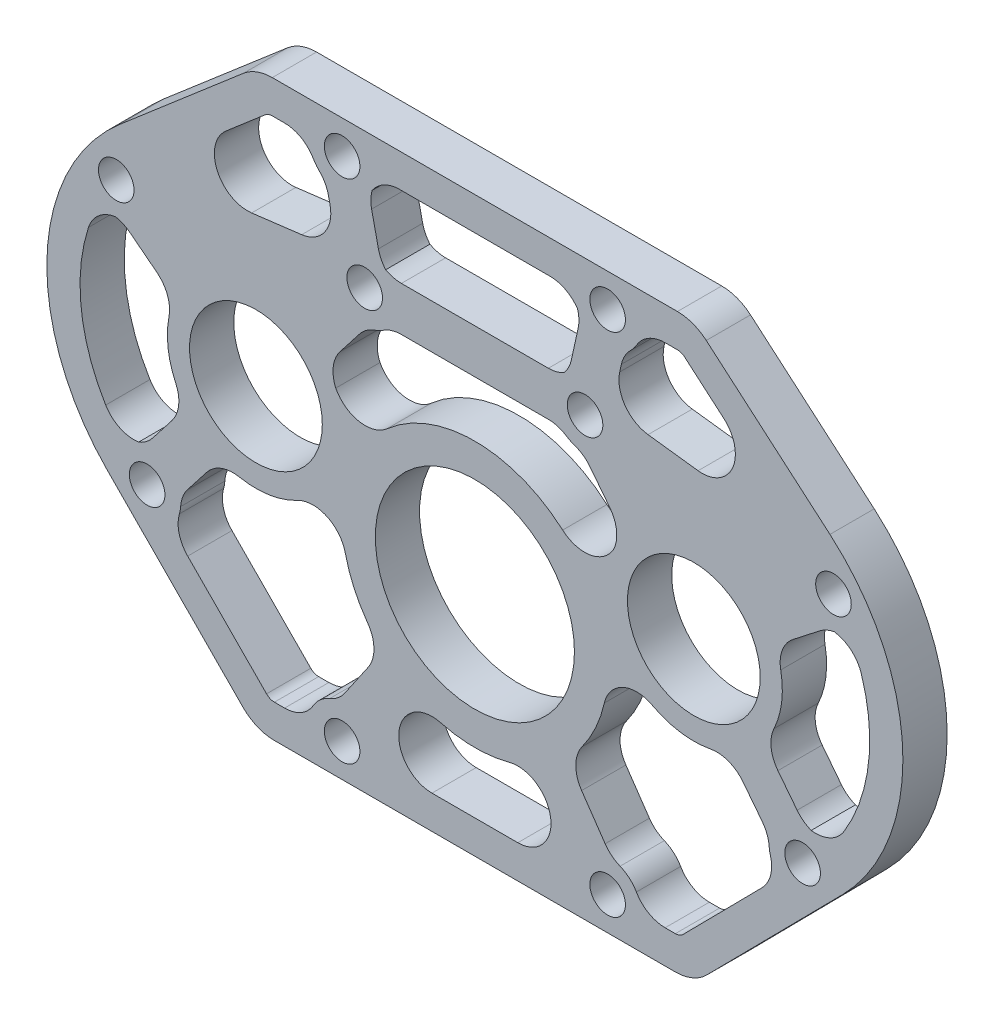
from build123d import *

# Parameters (mm, degrees)
SKETCH3_R           = 9.524999999999967
SKETCH3_R_2         = 14.287499999999966
SKETCH3_R_3         = 9.525000000000205
SKETCH3_R_4         = 2.552699999999982
SKETCH3_R_5         = 2.5527000000000264
SKETCH3_R_6         = 2.5526999999999824
SKETCH3_R_7         = 2.5527000000000104
SKETCH3_R_8         = 2.5526999999999833
SKETCH3_R_9         = 2.5527000000000126
SKETCH3_R_10        = 2.552700000000041
BOSS_EXTRUDE1_DEPTH = 6.35
FILLET1_R           = 6.35
CUT_EXTRUDE1_DEPTH  = 6.35
FILLET2_R           = 4.7625
BOSS_EXTRUDE2_START = -6.35
BOSS_EXTRUDE2_DEPTH = 6.35


with BuildPart() as part:
    # Sketch3 → Boss-Extrude1 (new body)
    with BuildSketch(Plane.XY):
        with BuildLine():
            Line((165.25031901296043, 45.63039842922551), (145.7180648672066, 62.3849999439999))
            Line((145.7180648672066, 62.3849999439999), (82.88193513279336, 62.384999943999894))
            Line((82.88193513279336, 62.384999943999894), (63.34968098703953, 45.630398429225515))
            ThreePointArc((63.34968098703952, 45.63039842922552), (52.907631648873384, 24.101421481148385), (61.53367702041241, 1.7827166786809485))
            Line((61.53367702041244, 1.782716678680977), (82.88193513279337, -19.8399999439999))
            Line((82.88193513279337, -19.8399999439999), (145.71806486720664, -19.83999994399989))
            Line((145.71806486720664, -19.83999994399989), (167.06632297958757, 1.7827166786809805))
            ThreePointArc((167.0663229795876, 1.7827166786809663), (175.6923683511266, 24.1014214811484), (165.25031901296046, 45.63039842922552))
        make_face()
        with Locations((145.71806486720658, 22.859999999999996)):
            Circle(SKETCH3_R, mode=Mode.SUBTRACT)
        with Locations((114.30000000000001, 12.700000000000026)):
            Circle(SKETCH3_R_2, mode=Mode.SUBTRACT)
        with Locations((82.88193513279316, 22.859999999999978)):
            Circle(SKETCH3_R_3, mode=Mode.SUBTRACT)
        with Locations((67.27202122811511, 2.8227699546935)):
            Circle(SKETCH3_R_4, mode=Mode.SUBTRACT)
        with Locations((62.84470508748691, 38.46991390467836)):
            Circle(SKETCH3_R_5, mode=Mode.SUBTRACT)
        with Locations((98.49184903747175, 42.89723004530641)):
            Circle(SKETCH3_R_5, mode=Mode.SUBTRACT)
        with Locations((133.35, 57.622499943999905)):
            Circle(SKETCH3_R_6, mode=Mode.SUBTRACT)
        with Locations((95.25, 57.6224999439999)):
            Circle(SKETCH3_R_7, mode=Mode.SUBTRACT)
        with Locations((133.35, -15.077499943999886)):
            Circle(SKETCH3_R_8, mode=Mode.SUBTRACT)
        with Locations((95.25000000000001, -15.077499943999891)):
            Circle(SKETCH3_R_7, mode=Mode.SUBTRACT)
        with Locations((165.75529491251308, 38.46991390467837)):
            Circle(SKETCH3_R_9, mode=Mode.SUBTRACT)
        with Locations((130.10815096252827, 42.897230045306415)):
            Circle(SKETCH3_R_9, mode=Mode.SUBTRACT)
        with Locations((161.3279787718849, 2.8227699546935114)):
            Circle(SKETCH3_R_10, mode=Mode.SUBTRACT)
    extrude(amount=BOSS_EXTRUDE1_DEPTH)

    # Fillet1
    fillet1_edges = [part.edges().sort_by_distance(p)[0] for p in [
        (145.71806486720664, -19.83999994399989, 3.175),
        (82.88193513279337, -19.8399999439999, 3.175),
        (82.88193513279336, 62.384999943999894, 3.175),
        (145.7180648672066, 62.3849999439999, 3.175),
    ]]
    fillet(fillet1_edges, radius=FILLET1_R)

    # Sketch4 → Cut-Extrude1 (cut)
    with BuildSketch(Plane.XY.offset(6.35)):
        with BuildLine():
            ThreePointArc((60.496530836135214, 34.51440165339059), (57.823864026699304, 19.85592345880994), (63.88564781528261, 6.244571279260505))
            ThreePointArc((63.885647815282695, 6.244571279260578), (65.31222342798739, 7.2199783621449605), (66.99134243143186, 7.628752539872069))
            Line((66.99134243143186, 7.628752539872053), (72.82016430356113, 15.110756954384843))
            ThreePointArc((72.8201643035614, 15.110756954384724), (70.27876652430976, 21.29470736725245), (71.23021361100872, 27.912463317905523))
            Line((71.23021361100876, 27.912463317905534), (63.519265514537196, 33.91964273528012))
            ThreePointArc((63.51926551453721, 33.91964273528018), (61.956628316655134, 33.956454130413434), (60.49653083613537, 34.51440165339052))
        make_face()
        with BuildLine():
            Line((84.19872055577194, 57.23993352979563), (66.5888336679094, 42.13432230209572))
            Line((66.5888336679094, 42.13432230209572), (94.57783316172741, 45.610509605989485))
            ThreePointArc((94.57783316172737, 45.610509605989556), (94.60269670751516, 45.646029856932046), (94.62788259468194, 45.6813222813852))
            Line((94.62788259468196, 45.68132228138519), (92.91247649564257, 53.47311563827748))
            ThreePointArc((92.91247649564247, 53.47311563827742), (91.13819614162453, 55.21948615289328), (90.48750000000001, 57.6224999439999))
            Line((90.48750000000001, 57.622499943999884), (85.23230233958077, 57.622499943999884))
            ThreePointArc((85.23230233958077, 57.622499943999884), (84.68124690564092, 57.52378943842996), (84.19872055577194, 57.23993352979563))
        make_face()
        with BuildLine():
            Line((102.04160695175264, 46.072230045306405), (126.55839304824734, 46.072230045306405))
            ThreePointArc((126.55839304824734, 46.07223004530641), (127.12446585525399, 46.60924155264711), (127.77062745817099, 47.046614351029056))
            Line((127.77062745817089, 47.04661435102912), (129.48603355721013, 54.83840770792082))
            ThreePointArc((129.4860335572104, 54.83840770792085), (128.81769669848842, 56.15975149224643), (128.5875, 57.622499943999905))
            Line((128.5875, 57.62249994399989), (100.01249999999999, 57.62249994399989))
            ThreePointArc((100.01249999999999, 57.6224999439999), (99.78230330151163, 56.15975149224657), (99.11396644278982, 54.838407707921114))
            Line((99.11396644278979, 54.838407707921114), (100.82937254182919, 47.04661435102882))
            ThreePointArc((100.82937254182929, 47.046614351028886), (101.47553414474612, 46.60924155264701), (102.04160695175264, 46.072230045306426))
        make_face()
        with BuildLine():
            Line((134.02216683827268, 45.61050960598948), (162.0111663320905, 42.13432230209575))
            Line((162.0111663320905, 42.134322302095754), (144.401279444228, 57.23993352979562))
            ThreePointArc((144.401279444228, 57.23993352979562), (143.91875309435903, 57.52378943842998), (143.36769766041917, 57.6224999439999))
            Line((143.36769766041917, 57.6224999439999), (138.11249999999998, 57.6224999439999))
            ThreePointArc((138.11249999999998, 57.622499943999905), (137.46180385837545, 55.21948615289329), (135.68752350435753, 53.473115638277434))
            Line((135.68752350435744, 53.47311563827749), (133.97211740531813, 45.68132228138553))
            ThreePointArc((133.9721174053179, 45.6813222813855), (133.9973032924848, 45.64602985693218), (134.02216683827268, 45.61050960598952))
        make_face()
        with BuildLine():
            Line((155.77983569643882, 15.110756954384893), (161.60865756856813, 7.62875253987205))
            ThreePointArc((161.60865756856816, 7.62875253987208), (163.2877765720126, 7.219978362144969), (164.71435218471728, 6.244571279260601))
            ThreePointArc((164.71435218471737, 6.244571279260526), (170.77613597330068, 19.855923458809986), (168.10346916386473, 34.51440165339064))
            ThreePointArc((168.10346916386464, 34.51440165339059), (166.64337168334487, 33.9564541304135), (165.08073448546278, 33.919642735280235))
            Line((165.0807344854628, 33.91964273528014), (157.3697863889912, 27.912463317905512))
            ThreePointArc((157.36978638899123, 27.912463317905495), (158.1532340121492, 25.44003262317893), (158.4180648672066, 22.860000000000007))
            ThreePointArc((158.4180648672066, 22.860000000000003), (157.74042922558564, 18.766987022451943), (155.77983569643857, 15.110756954384756))
        make_face()
        with BuildLine():
            ThreePointArc((133.96072796033513, -10.35432118298893), (136.92700979598158, -11.933234184008853), (138.1125, -15.077499943999886))
            Line((138.1125, -15.077499943999893), (143.06401926518333, -15.077499943999893))
            ThreePointArc((143.06401926518333, -15.077499943999896), (143.67620986874843, -14.954711149291434), (144.19369792573892, -14.605339521834987))
            Line((144.19369792573892, -14.605339521834988), (157.98262159450593, -0.6391420245032702))
            ThreePointArc((157.98262159450604, -0.6391420245033945), (156.7386949005237, 1.368561323165178), (156.59935005724137, 3.726274063702494))
            Line((156.59935005724148, 3.726274063702526), (150.7705281851121, 11.208278478215417))
            ThreePointArc((150.77052818511208, 11.20827847821537), (141.9880352850519, 10.720112055037319), (134.99483005944168, 16.055425416858252))
            Line((134.9948300594417, 16.055425416858295), (133.1492094600955, 15.45858708933515))
            ThreePointArc((133.14920946009548, 15.458587089335271), (133.29973605362477, 14.082942476240643), (133.35, 12.700000000000003))
            ThreePointArc((133.35, 12.699999999999998), (131.837998184808, 5.262183138200293), (127.54200843363024, -0.9949520862128409))
            Line((127.5420084336305, -0.9949520862127166), (133.9607279603351, -10.354321182988988))
        make_face()
        with BuildLine():
            Line((100.01250000000005, -15.077499943999895), (128.58749999999998, -15.077499943999895))
            ThreePointArc((128.58749999999998, -15.077499943999886), (128.6217294764573, -14.50753143066147), (128.7239258713689, -13.945755977190231))
            Line((128.72392587136892, -13.945755977190235), (122.30520634466431, -4.586386880413963))
            ThreePointArc((122.30520634466443, -4.586386880413858), (114.3, -6.349999999999998), (106.29479365533557, -4.586386880413855))
            Line((106.29479365533568, -4.586386880413974), (99.87607412863113, -13.945755977190192))
            ThreePointArc((99.87607412863113, -13.945755977190188), (99.97827052354275, -14.50753143066145), (100.01250000000005, -15.077499943999891))
        make_face()
        with BuildLine():
            Line((85.5359807348167, -15.077499943999896), (90.48749999999998, -15.077499943999896))
            ThreePointArc((90.48749999999998, -15.077499943999891), (91.67299020401843, -11.933234184008843), (94.63927203966489, -10.354321182988919))
            Line((94.63927203966493, -10.354321182988974), (101.0579915663695, -0.9949520862127237))
            ThreePointArc((101.05799156636976, -0.9949520862128534), (96.26832497170686, 6.5549861127878835), (95.45079053990455, 15.458587089335397))
            Line((95.45079053990442, 15.45858708933517), (93.6051699405583, 16.05542541685829))
            ThreePointArc((93.60516994055828, 16.05542541685825), (86.61196471494809, 10.720112055037303), (77.82947181488785, 11.208278478215364))
            Line((77.82947181488782, 11.208278478215387), (72.00064994275856, 3.7262740637025864))
            ThreePointArc((72.0006499427586, 3.7262740637025806), (72.06475947221311, 3.2765422759159972), (72.08619293215176, 2.8227699546935))
            ThreePointArc((72.08619293215176, 2.8227699546934986), (71.70380264528704, 0.9424607603435913), (70.61737840549404, -0.6391420245033248))
            Line((70.61737840549408, -0.6391420245032773), (84.40630207426113, -14.605339521834996))
            ThreePointArc((84.40630207426113, -14.605339521834992), (84.92379013125161, -14.954711149291443), (85.5359807348167, -15.077499943999896))
        make_face()
        with BuildLine():
            ThreePointArc((97.4046366937507, 21.500522640721115), (114.3, 31.750000000000004), (131.1953633062493, 21.50052264072111))
            Line((131.1953633062493, 21.50052264072101), (133.04098390559543, 22.097360968244132))
            ThreePointArc((133.04098390559554, 22.09736096824397), (133.57817692224393, 26.590029582154763), (135.65629403797465, 30.609243045615255))
            Line((135.6562940379744, 30.60924304561513), (129.78504899522622, 38.14570277833997))
            ThreePointArc((129.78504899522622, 38.14570277833997), (128.01742848657267, 38.61817807336985), (126.55839304824735, 39.722230045306404))
            Line((126.55839304824735, 39.72223004530641), (102.04160695175264, 39.72223004530641))
            ThreePointArc((102.04160695175264, 39.72223004530639), (100.58257151342733, 38.61817807336985), (98.8149510047738, 38.145702778339974))
            Line((98.8149510047738, 38.14570277833998), (92.94370596202562, 30.609243045615134))
            ThreePointArc((92.94370596202535, 30.609243045615255), (94.90429949117242, 26.953012977548074), (95.58193513279336, 22.860000000000007))
            ThreePointArc((95.58193513279336, 22.860000000000003), (95.57620408008728, 22.478508330668085), (95.55901609440444, 22.097360968243873))
            Line((95.5590160944046, 22.09736096824412), (97.40463669375069, 21.50052264072101))
        make_face()
    extrude(amount=-CUT_EXTRUDE1_DEPTH, mode=Mode.SUBTRACT)

    # Fillet2
    # the kernel refuses this fillet: 4.7625 mm, written as the material it adds along each edge
    with BuildSketch(Plane(origin=(66.5888336679094, 42.13432230209572, 6.35), x_dir=(0.7590132823910112, 0.6510751394071371, 0), z_dir=(0, 0, -1))) as fillet2_piece_1:
        with BuildLine():
            CenterArc((FILLET2_R * 3.31813178177, FILLET2_R), FILLET2_R, 123.54292504537948, 146.4570749546204)
            Line((FILLET2_R * 2.76557021802, FILLET2_R * 1.83347208607), (FILLET2_R * 2.75451898675, FILLET2_R * 1.85014152779))
            Line((FILLET2_R * 2.75451898675, FILLET2_R * 1.85014152779), (-FILLET2_R * 0.011051231275, FILLET2_R * 0.0166694417215))
            Line((-FILLET2_R * 0.011051231275, FILLET2_R * 0.0166694417215), (1.51e-15, -FILLET2_R * 0.02))
            Line((1.51e-15, -FILLET2_R * 0.02), (FILLET2_R * 3.31813178177, -FILLET2_R * 0.02))
            Line((FILLET2_R * 3.31813178177, -FILLET2_R * 0.02), (FILLET2_R * 3.31813178177, 9.9e-16))
        make_face()
    extrude(amount=6.35)
    with BuildSketch(Plane(origin=(92.91247649564252, 53.47311563827745, 6.35), x_dir=(-0.8016652069607583, 0.597773281394012, 0), z_dir=(0, 0, -1))) as fillet2_piece_2:
        with BuildLine():
            CenterArc((1.8194394249013912, -4.723726123742109), FILLET2_R, 97.31618767115063, 33.55730976192706)
            Line((-1.2970982761582734, -1.1225320151340035), (-1.359429030179462, -1.050508132961845))
            Line((-1.359429030179462, -1.050508132961845), (-0.06233075402118434, 0.07202388217216413))
            Line((-0.06233075402118434, 0.07202388217216413), (0.01212959616600531, 0.0944745224748415))
            ThreePointArc((0.01212959616600531, 0.0944745224748415), (0.6064798083003866, 0.05647612374210674), (1.2008300204347633, 0.09447452247484149))
            Line((1.2008300204347633, 0.09447452247484149), (1.21295961660077, -5e-17))
        make_face()
    extrude(amount=6.35)
    with BuildSketch(Plane(origin=(90.48750000000001, 57.62249994399989, 6.35), x_dir=(0.25881904510251974, -0.9659258262890684, 0), z_dir=(0, 0, -1))) as fillet2_piece_3:
        with BuildLine():
            CenterArc((3.697877106902281, 4.60022174770168), FILLET2_R, 194.99999999999994, 59.999999999999886)
            Line((-0.9023446407994101, 3.367596045400928), (-0.994349075753444, 3.3429435313549134))
            Line((-0.994349075753444, 3.3429435313549134), (-0.09200443495403382, -0.02465251404601502))
            Line((-0.09200443495403382, -0.02465251404601502), (0.02465251404601318, -0.09200443495402696))
            ThreePointArc((0.02465251404601318, -0.09200443495402696), (1.2326257023007545, 0.06702825229831504), (2.440598890555493, -0.0920044349540378))
            Line((2.440598890555493, -0.0920044349540378), (2.465251404601511, 1e-17))
        make_face()
    extrude(amount=6.35)
    with BuildSketch(Plane(origin=(100.01249999999999, 57.6224999439999, 6.35), x_dir=(1, -2.04e-15, 0), z_dir=(0, 0, -1))) as fillet2_piece_4:
        with BuildLine():
            CenterArc((3.486391971046795, 4.762500000000003), FILLET2_R, 210.00000000000009, 59.99999999999977)
            Line((-0.6380540144765896, 2.3812499999999956), (-0.7205429341870607, 2.333624999999992))
            ThreePointArc((-0.7205429341870607, 2.333624999999992), (-0.2542826872523396, 1.207973188254734), (-0.09524999999999295, 1.9e-16))
            Line((-0.09524999999999295, 1.9e-16), (-1.9e-16, -0.09525000000000006))
            Line((-1.9e-16, -0.09525000000000006), (3.4863919710467854, -0.09525000000000006))
            Line((3.4863919710467854, -0.09525000000000006), (3.4863919710467854, 0))
        make_face()
    extrude(amount=6.35)
    with BuildSketch(Plane(origin=(72.82016430356126, 15.110756954384783, 6.35), x_dir=(-0.6145635395542969, -0.788867324618338, 0), z_dir=(0, 0, -1))) as fillet2_piece_5:
        with BuildLine():
            CenterArc((3.257537742465876, 4.762499999999997), FILLET2_R, 207.0356917894081, 62.96430821058965)
            Line((-0.9845331302633274, 2.597727272727581), (-1.069374547717912, 2.5544318181821315))
            ThreePointArc((-1.069374547717912, 2.5544318181821315), (-0.5100912405571059, 1.292108122158439), (-0.09222541593156659, -0.02381249999999701))
            Line((-0.09222541593156659, -0.02381249999999701), (-4.96e-15, -0.09525000000000117))
            Line((-4.96e-15, -0.09525000000000117), (3.2575377424656824, -0.09525000000000121))
            Line((3.2575377424656824, -0.09525000000000121), (3.2575377424656877, 9e-17))
        make_face()
    extrude(amount=6.35)
    with BuildSketch(Plane(origin=(66.99134243143186, 7.628752539872061, 6.35), x_dir=(-0.9826101519740424, -0.18568061082824244, 0), z_dir=(0, 0, -1))) as fillet2_piece_6:
        with BuildLine():
            CenterArc((1.8431219347915202, 4.723277734661305), FILLET2_R, 228.6210292094427, 34.02054386109012)
            Line((-1.3050644360511579, 1.1497180493558439), (-1.3680281634680114, 1.0782468556497347))
            Line((-1.3680281634680114, 1.0782468556497347), (-0.06296372741685324, -0.0714711937061109))
            Line((-0.06296372741685324, -0.0714711937061109), (0.01219924081658348, -0.0944655546932273))
            ThreePointArc((0.01219924081658348, -0.0944655546932273), (0.6165799469810707, -0.05560218478492761), (1.2209606531455242, -0.09446555469322657))
            Line((1.2209606531455242, -0.09446555469322657), (1.2331598939621151, 0))
        make_face()
    extrude(amount=6.35)
    with BuildSketch(Plane(origin=(63.88564781528265, 6.244571279260544, 6.35), x_dir=(-0.591356014225574, 0.8064106053613398, 0), z_dir=(0, 0, -1))) as fillet2_piece_7:
        with BuildLine():
            CenterArc((3.9219725254722304, 4.74493914842053), FILLET2_R, 204.9363673581168, 69.985460961988)
            Line((-0.3965509723674407, 2.7370145859414974), (-0.4829214423242333, 2.6968560946919156))
            ThreePointArc((-0.4829214423242333, 2.6968560946919156), (-0.09176975215493151, 1.3839383223152002), (-0.09421636379691611, 0.01399425928325179))
            Line((-0.09421636379691611, 0.01399425928325179), (-0.00817211668507584, -0.09489878296840897))
            ThreePointArc((-0.00817211668507584, -0.09489878296840897), (2.165289179863025, -0.18830868572252932), (4.338750476411142, -0.0948987829684104))
            Line((4.338750476411142, -0.0948987829684104), (4.330578359726065, 3e-17))
        make_face()
    extrude(amount=6.35)
    with BuildSketch(Plane(origin=(60.49653083613529, 34.51440165339056, 6.35), x_dir=(-0.3852189872298827, -0.9228251903137362, 0), z_dir=(0, 0, -1))) as fillet2_piece_8:
        with BuildLine():
            CenterArc((3.861119378985338, -4.745480837148517), FILLET2_R, 85.15472255976059, 68.85879163585292)
            Line((-0.41987957745789506, -2.658747939786717), (-0.5054995565867587, -2.617013281839483))
            ThreePointArc((-0.5054995565867587, -2.617013281839483), (-0.10520241415883218, -1.345914494070335), (-0.0943142248331583, -0.013318764737047))
            Line((-0.0943142248331583, -0.013318764737047), (-0.00804531849601996, 0.09490961674297414))
            ThreePointArc((-0.00804531849601996, 0.09490961674297414), (2.1316926518932866, 0.18543816199709776), (4.271430622282594, 0.09490961674297345))
            Line((4.271430622282594, 0.09490961674297345), (4.26338530378657, -2e-17))
        make_face()
    extrude(amount=6.35)
    with BuildSketch(Plane(origin=(63.5192655145372, 33.91964273528015, 6.35), x_dir=(0.7888673246183513, -0.6145635395542798, 0), z_dir=(0, 0, -1))) as fillet2_piece_9:
        with BuildLine():
            CenterArc((1.6365588563594557, 4.762500000000001), FILLET2_R, 237.97286866510677, 32.02713133489215)
            Line((-0.8890938677932282, 0.7248664645017452), (-0.9396069222762806, 0.6441137937917798))
            ThreePointArc((-0.9396069222762806, 0.6441137937917798), (-0.4820505557634345, 0.3164327040779696), (-0.06892309620878131, -0.0657432073220927))
            Line((-0.06892309620878131, -0.0657432073220927), (-9e-17, -0.09525000000000336))
            Line((-9e-17, -0.09525000000000336), (1.636558856359359, -0.09524999999999907))
            Line((1.636558856359359, -0.09524999999999907), (1.636558856359365, -2e-17))
        make_face()
    extrude(amount=6.35)
    with BuildSketch(Plane(origin=(71.23021361100874, 27.91246331790553, 6.35), x_dir=(-0.2951012881785467, -0.9554659751740836, 0), z_dir=(0, 0, -1))) as fillet2_piece_10:
        with BuildLine():
            CenterArc((3.2989195561818025, 4.733929462446588), FILLET2_R, 200.75660198765817, 62.96430821060136)
            Line((-1.1544674275659685, 3.046105234931795), (-1.2435351672409234, 3.0123487503815016))
            Line((-1.2435351672409234, 3.0123487503815016), (-0.08906773967494891, -0.03375648455031036))
            Line((-0.08906773967494891, -0.03375648455031036), (0.01041764070373172, -0.09467858924893438))
            ThreePointArc((0.01041764070373172, -0.09467858924893438), (1.3890187604975808, -0.01906189985757902), (2.767619880291456, -0.09467858924892951))
            Line((2.767619880291456, -0.09467858924892951), (2.7780375209951886, 3e-17))
        make_face()
    extrude(amount=6.35)
    with BuildSketch(Plane(origin=(138.1125, -15.07749994399989, 6.35), x_dir=(-0.2588190451025203, 0.9659258262890684, 0), z_dir=(0, 0, -1))) as fillet2_piece_11:
        with BuildLine():
            CenterArc((3.6978771069022636, 4.600221747701678), FILLET2_R, 194.99999999999963, 60.00000000000034)
            Line((-0.9023446407994331, 3.367596045400952), (-0.9943490757534669, 3.342943531354937))
            Line((-0.9943490757534669, 3.342943531354937), (-0.09200443495403382, -0.02465251404601507))
            Line((-0.09200443495403382, -0.02465251404601507), (0.02465251404601324, -0.09200443495402696))
            ThreePointArc((0.02465251404601324, -0.09200443495402696), (1.232625702300751, 0.06702825229832943), (2.4405988905554916, -0.09200443495403696))
            Line((2.4405988905554916, -0.09200443495403696), (2.465251404601506, -4e-17))
        make_face()
    extrude(amount=6.35)
    with BuildSketch(Plane(origin=(128.58749999999998, -15.07749994399989, 6.35), x_dir=(-1, -1.21e-15, 0), z_dir=(0, 0, -1))) as fillet2_piece_12:
        with BuildLine():
            CenterArc((2.945621642452346, 4.762499999999999), FILLET2_R, 229.67300168336476, 40.3269983166353)
            Line((-0.1364258713689437, 1.1317439668096616), (-0.19806682164537065, 1.0591288461458548))
            ThreePointArc((-0.19806682164537065, 1.0591288461458548), (-0.12879488692817698, 0.5585691430716507), (-0.09524999999999295, -5.44e-15))
            Line((-0.09524999999999295, -5.44e-15), (1.1e-16, -0.09525000000000006))
            Line((1.1e-16, -0.09525000000000006), (2.945621642452352, -0.09525000000000006))
            Line((2.945621642452352, -0.09525000000000006), (2.945621642452352, 0))
        make_face()
    extrude(amount=6.35)
    with BuildSketch(Plane(origin=(90.48749999999998, -15.077499943999893, 6.35), x_dir=(-1, -1.02e-15, 0), z_dir=(0, 0, -1))) as fillet2_piece_13:
        with BuildLine():
            CenterArc((3.4863919710467663, 4.762499999999999), FILLET2_R, 210.00000000000003, 60)
            Line((-0.6380540144766254, 2.3812499999999956), (-0.7205429341870963, 2.333624999999995))
            ThreePointArc((-0.7205429341870963, 2.333624999999995), (-0.25428268725234326, 1.2079731882547387), (-0.09524999999999295, -1e-16))
            Line((-0.09524999999999295, -1e-16), (1e-16, -0.09525000000000006))
            Line((1e-16, -0.09525000000000006), (3.4863919710467712, -0.09525000000000006))
            Line((3.4863919710467712, -0.09525000000000006), (3.4863919710467712, 0))
        make_face()
    extrude(amount=6.35)
    with BuildSketch(Plane(origin=(100.01250000000005, -15.077499943999893, 6.35), x_dir=(-0.11967842799757047, 0.992812708355423, 0), z_dir=(0, 0, -1))) as fillet2_piece_14:
        with BuildLine():
            CenterArc((4.375743155898374, 3.494419113971969), FILLET2_R, 186.8735441156789, 40.32699831663598)
            Line((-0.35252736764432757, 2.9244506006335396), (-0.44709277811518167, 2.913051230366771))
            Line((-0.44709277811518167, 2.913051230366771), (-0.0945654104708541, -0.01139937026676859))
            Line((-0.0945654104708541, -0.01139937026676859), (0.01139937026676774, -0.09456541047084704))
            ThreePointArc((0.01139937026676774, -0.09456541047084704), (0.5699685133384385, -0.06102052354269744), (1.075220904092454, -0.06988838227943955))
            Line((1.075220904092454, -0.06988838227943955), (1.1399370266768831, 0))
        make_face()
    extrude(amount=6.35)
    with BuildSketch(Plane(origin=(106.29479365533562, -4.586386880413914, 6.35), x_dir=(-0.565580282551364, -0.8246932423568895, 0), z_dir=(0, 0, -1))) as fillet2_piece_15:
        with BuildLine():
            CenterArc((3.66708699133166, -4.762500000000005), FILLET2_R, 90.00000000000122, 70.52877936550922)
            Line((-0.8230410692029484, -3.175000000000093), (-0.9128436304136406, -3.1432500000000956))
            ThreePointArc((-0.9128436304136406, -3.1432500000000956), (-0.4352637875949267, -1.5813451425732565), (-0.09391776655670302, 0.01587500000000335))
            Line((-0.09391776655670302, 0.01587500000000335), (-3.6e-16, 0.09525000000000308))
            Line((-3.6e-16, 0.09525000000000308), (3.6670869913315594, 0.09525000000000311))
            Line((3.6670869913315594, 0.09525000000000311), (3.6670869913315594, 5e-17))
        make_face()
    extrude(amount=6.35)
    with BuildSketch(Plane(origin=(122.30520634466437, -4.586386880413911, 6.35), x_dir=(0.5655802825513677, -0.8246932423568869, 0), z_dir=(0, 0, -1))) as fillet2_piece_16:
        with BuildLine():
            CenterArc((3.667086991331656, 4.762499999999998), FILLET2_R, 199.47122063448964, 70.5287793655092)
            Line((-0.8230410692029502, 3.1750000000000806), (-0.9128436304136424, 3.1432500000000827))
            ThreePointArc((-0.9128436304136424, 3.1432500000000827), (-0.4352637875949226, 1.5813451425732448), (-0.09391776655670293, -0.01587500000000376))
            Line((-0.09391776655670293, -0.01587500000000376), (6e-17, -0.09525000000000308))
            Line((6e-17, -0.09525000000000308), (3.6670869913315607, -0.09525000000000296))
            Line((3.6670869913315607, -0.09525000000000296), (3.6670869913315607, 7e-17))
        make_face()
    extrude(amount=6.35)
    with BuildSketch(Plane(origin=(101.05799156636962, -0.9949520862127894, 6.35), x_dir=(-0.5655802825514147, -0.8246932423568548, 0), z_dir=(0, 0, -1))) as fillet2_piece_17:
        with BuildLine():
            CenterArc((3.6670869913317263, 4.762500000000004), FILLET2_R, 199.4712206344885, 70.5287793655092)
            Line((-0.8230410692029066, 3.175000000000177), (-0.912843630413598, 3.1432500000001826))
            ThreePointArc((-0.912843630413598, 3.1432500000001826), (-0.43526378759492107, 1.581345142573291), (-0.09391776655670711, -0.01587499999999545))
            Line((-0.09391776655670711, -0.01587499999999545), (-5.67e-15, -0.09525000000000297))
            Line((-5.67e-15, -0.09525000000000297), (3.667086991331528, -0.09525000000000296))
            Line((3.667086991331528, -0.09525000000000296), (3.667086991331533, 1.7e-16))
        make_face()
    extrude(amount=6.35)
    with BuildSketch(Plane(origin=(94.63927203966492, -10.354321182988947, 6.35), x_dir=(-0.9673389948731187, -0.25348623039104995, 0), z_dir=(0, 0, -1))) as fillet2_piece_18:
        with BuildLine():
            CenterArc((1.819439424901319, 4.7237261237421215), FILLET2_R, 229.1265025669228, 33.5573097619278)
            Line((-1.2970982761583212, 1.1225320151339846), (-1.3594290301795153, 1.0505081329618224))
            Line((-1.3594290301795153, 1.0505081329618224), (-0.06233075402119322, -0.07202388217216563))
            Line((-0.06233075402119322, -0.07202388217216563), (0.01212959616601017, -0.09447452247484203))
            ThreePointArc((0.01212959616601017, -0.09447452247484203), (0.6064798083003978, -0.05647612374212383), (1.2008300204347877, -0.09447452247484316))
            Line((1.2008300204347877, -0.09447452247484316), (1.212959616600799, -4e-17))
        make_face()
    extrude(amount=6.35)
    with BuildSketch(Plane(origin=(70.61737840549407, -0.6391420245033002, 6.35), x_dir=(0.5141469036715977, 0.8577021402823414, 0), z_dir=(0, 0, -1))) as fillet2_piece_19:
        with BuildLine():
            CenterArc((3.7344439594515775, 4.599349763288074), FILLET2_R, 194.42549715385275, 60.53402401097742)
            Line((-0.8779058261063024, 3.412911519777601), (-0.9701528218174595, 3.389182754907392))
            Line((-0.9701528218174595, 3.389182754907392), (-0.09224699571115741, -0.02372876487020891))
            Line((-0.09224699571115741, -0.02372876487020891), (0.02471750800503391, -0.09198699526574747))
            ThreePointArc((0.02471750800503391, -0.09198699526574747), (1.2492842796010049, 0.06967036810188554), (2.4738510511970437, -0.0919869952657626))
            Line((2.4738510511970437, -0.0919869952657626), (2.4985685592020355, -1.1e-16))
        make_face()
    extrude(amount=6.35)
    with BuildSketch(Plane(origin=(72.00064994275857, 3.7262740637025837, 6.35), x_dir=(0.6145635395542597, 0.7888673246183668, 0), z_dir=(0, 0, -1))) as fillet2_piece_20:
        with BuildLine():
            CenterArc((1.7392655850273198, 4.762500000000003), FILLET2_R, 235.97945613891187, 34.02054386108841)
            Line((-0.9253061380782163, 0.8151637104971269), (-0.9785975725403306, 0.7362169847070646))
            ThreePointArc((-0.9785975725403306, 0.7362169847070646), (-0.49940814312402615, 0.3658605479597859), (-0.07159892639849413, -0.06281843868311499))
            Line((-0.07159892639849413, -0.06281843868311499), (-4.7e-16, -0.09525000000000117))
            Line((-4.7e-16, -0.09525000000000117), (1.7392655850273404, -0.0952500000000012))
            Line((1.7392655850273404, -0.0952500000000012), (1.7392655850273409, -9e-17))
        make_face()
    extrude(amount=6.35)
    with BuildSketch(Plane(origin=(77.82947181488784, 11.208278478215377, 6.35), x_dir=(0.955465975174084, -0.29510128817854503, 0), z_dir=(0, 0, -1))) as fillet2_piece_21:
        with BuildLine():
            CenterArc((3.2989195561818043, 4.73392946244659), FILLET2_R, 200.75660198765945, 62.964308210600166)
            Line((-1.1544674275659328, 3.046105234931697), (-1.243535167240892, 3.012348750381401))
            Line((-1.243535167240892, 3.012348750381401), (-0.08906773967494988, -0.0337564845503139))
            Line((-0.08906773967494988, -0.0337564845503139), (0.01041764070372562, -0.09467858924893056))
            ThreePointArc((0.01041764070372562, -0.09467858924893056), (1.3890187604975937, -0.01906189985757128), (2.7676198802914618, -0.09467858924893023))
            Line((2.7676198802914618, -0.09467858924893023), (2.7780375209951984, -1e-17))
        make_face()
    extrude(amount=6.35)
    with BuildSketch(Plane(origin=(150.77052818511208, 11.208278478215393, 6.35), x_dir=(0.6145635395542773, -0.7888673246183532, 0), z_dir=(0, 0, -1))) as fillet2_piece_22:
        with BuildLine():
            CenterArc((3.2575377424657237, 4.762499999999998), FILLET2_R, 207.03569178941143, 62.964308210589365)
            Line((-0.9845331302633575, 2.597727272727334), (-1.0693745477179362, 2.554431818181877))
            ThreePointArc((-1.0693745477179362, 2.554431818181877), (-0.5100912405570749, 1.2921081221583464), (-0.09222541593156906, -0.02381249999999568))
            Line((-0.09222541593156906, -0.02381249999999568), (-6.14e-15, -0.09524999999998995))
            Line((-6.14e-15, -0.09524999999998995), (3.257537742465785, -0.09524999999998987))
            Line((3.257537742465785, -0.09524999999998987), (3.257537742465791, 6e-17))
        make_face()
    extrude(amount=6.35)
    with BuildSketch(Plane(origin=(157.98262159450599, -0.6391420245033341, 6.35), x_dir=(-0.7025761120221313, -0.7116086050743524, 0), z_dir=(0, 0, -1))) as fillet2_piece_23:
        with BuildLine():
            CenterArc((3.524015278250666, 4.762500000000001), FILLET2_R, 209.46597598902392, 60.53402401097452)
            Line((-0.6224456257571677, 2.4197946788948013), (-0.7053748438373141, 2.3729405724727073))
            ThreePointArc((-0.7053748438373141, 2.3729405724727073), (-0.24374898455827956, 1.227253683627085), (-0.09524451331644654, 0.00102234197533013))
            Line((-0.09524451331644654, 0.00102234197533013), (-2.21e-15, -0.09524999999999958))
            Line((-2.21e-15, -0.09524999999999958), (3.5240152782505345, -0.09524999999999983))
            Line((3.5240152782505345, -0.09524999999999983), (3.5240152782505367, -2e-16))
        make_face()
    extrude(amount=6.35)
    with BuildSketch(Plane(origin=(133.96072796033513, -10.354321182988961, 6.35), x_dir=(-0.5655802825513995, 0.8246932423568651, 0), z_dir=(0, 0, -1))) as fillet2_piece_24:
        with BuildLine():
            CenterArc((1.7153839404090157, 4.762500000000006), FILLET2_R, 236.44269023807618, 33.55730976192501)
            Line((-0.917186986935793, 0.7937500000001516), (-0.9698384054826895, 0.7143750000001535))
            ThreePointArc((-0.9698384054826895, 0.7143750000001535), (-0.49555096724270503, 0.3541702264361706), (-0.0709951582856116, -0.06350000000000962))
            Line((-0.0709951582856116, -0.06350000000000962), (-3.57e-15, -0.09524999999999087))
            Line((-3.57e-15, -0.09524999999999087), (1.7153839404091131, -0.09524999999999093))
            Line((1.7153839404091131, -0.09524999999999093), (1.715383940409117, -1.2e-16))
        make_face()
    extrude(amount=6.35)
    with BuildSketch(Plane(origin=(127.54200843363037, -0.9949520862127779, 6.35), x_dir=(0.5655802825514157, -0.824693242356854, 0), z_dir=(0, 0, -1))) as fillet2_piece_25:
        with BuildLine():
            CenterArc((3.6670869913328517, -4.762500000000006), FILLET2_R, 90.00000000000234, 70.52877936550293)
            Line((-0.8230410692016128, -3.17499999999969), (-0.9128436304122972, -3.14324999999969))
            ThreePointArc((-0.9128436304122972, -3.14324999999969), (-0.4352637875935243, -1.581345142573231), (-0.0939177665567049, 0.01587500000001408))
            Line((-0.0939177665567049, 0.01587500000001408), (-5.79e-15, 0.09525000000000297))
            Line((-5.79e-15, 0.09525000000000297), (3.6670869913326594, 0.0952499999999914))
            Line((3.6670869913326594, 0.0952499999999914), (3.667086991332657, -2e-17))
        make_face()
    extrude(amount=6.35)
    with BuildSketch(Plane(origin=(156.59935005724142, 3.726274063702509, 6.35), x_dir=(-0.06033005160254165, -0.9981784834755931, 0), z_dir=(0, 0, -1))) as fillet2_piece_26:
        with BuildLine():
            CenterArc((1.843121934791713, 4.72327773466128), FILLET2_R, 228.62102920943806, 34.02054386109256)
            Line((-1.3050644360512482, 1.1497180493560815), (-1.3680281634681066, 1.0782468556499878))
            Line((-1.3680281634681066, 1.0782468556499878), (-0.06296372741685599, -0.07147119370609391))
            Line((-0.06296372741685599, -0.07147119370609391), (0.01219924081658454, -0.09446555469321849))
            ThreePointArc((0.01219924081658454, -0.09446555469321849), (0.6165799469810699, -0.05560218478490081), (1.2209606531455341, -0.09446555469323129))
            Line((1.2209606531455341, -0.09446555469323129), (1.233159893962126, 0))
        make_face()
    extrude(amount=6.35)
    with BuildSketch(Plane(origin=(157.3697863889912, 27.912463317905505, 6.35), x_dir=(0.7888673246183618, 0.6145635395542663, 0), z_dir=(0, 0, -1))) as fillet2_piece_27:
        with BuildLine():
            CenterArc((3.2575377424657077, 4.762500000000002), FILLET2_R, 207.03569178941044, 62.96430821058948)
            Line((-0.9845331302634001, 2.5977272727274174), (-1.0693745477179915, 2.554431818181957))
            ThreePointArc((-1.0693745477179915, 2.554431818181957), (-0.5100912405570531, 1.2921081221583834), (-0.09222541593155524, -0.02381249999999236))
            Line((-0.09222541593155524, -0.02381249999999236), (4.07e-15, -0.09524999999999899))
            Line((4.07e-15, -0.09524999999999899), (3.2575377424657037, -0.09524999999999904))
            Line((3.2575377424657037, -0.09524999999999904), (3.2575377424656997, 2e-17))
        make_face()
    extrude(amount=6.35)
    with BuildSketch(Plane(origin=(165.0807344854628, 33.91964273528019, 6.35), x_dir=(0.9997544703431432, -0.022158497893608107, 0), z_dir=(0, 0, -1))) as fillet2_piece_28:
        with BuildLine():
            CenterArc((1.7409647921555655, 4.72533308167698), FILLET2_R, 230.81009453353644, 32.027131334900616)
            Line((-1.2684244817750425, 1.034129694168859), (-1.328612267253666, 0.960305626418699))
            Line((-1.328612267253666, 0.960305626418699), (-0.06018778547859539, -0.07382406775017473))
            Line((-0.06018778547859539, -0.07382406775017473), (0.01187659070962121, -0.09450666163354161))
            ThreePointArc((0.01187659070962121, -0.09450666163354161), (0.5735676283374632, -0.05935124468145802), (1.135258665965301, -0.09450666163353903))
            Line((1.135258665965301, -0.09450666163353903), (1.1471352566749264, 0))
        make_face()
    extrude(amount=6.35)
    with BuildSketch(Plane(origin=(164.7143521847173, 6.244571279260564, 6.35), x_dir=(-0.8828706502658058, 0.46961624215867287, 0), z_dir=(0, 0, -1))) as fillet2_piece_29:
        with BuildLine():
            CenterArc((4.1335467564836, 4.561809643632263), FILLET2_R, 183.32207705428291, 69.98546096198811)
            Line((-0.6209501579619636, 4.285828954946143), (-0.7160400962508868, 4.280309341172427))
            ThreePointArc((-0.7160400962508868, 4.280309341172427), (-0.49683790415068896, 2.1159133939151684), (-0.09274638196689043, -0.02169495637359902))
            Line((-0.09274638196689043, -0.02169495637359902), (0.02735908642673105, -0.0912361928726445))
            ThreePointArc((0.02735908642673105, -0.0912361928726445), (1.382796217573444, 0.10761778685534233), (2.7382333487202004, -0.09123619287265101))
            Line((2.7382333487202004, -0.09123619287265101), (2.7655924351469228, 4e-17))
        make_face()
    extrude(amount=6.35)
    with BuildSketch(Plane(origin=(161.60865756856816, 7.628752539872066, 6.35), x_dir=(-0.6145635395542767, 0.7888673246183537, 0), z_dir=(0, 0, -1))) as fillet2_piece_30:
        with BuildLine():
            CenterArc((1.739265585027205, 4.7624999999999975), FILLET2_R, 235.97945613891306, 34.02054386108773)
            Line((-0.9253061380782518, 0.8151637104970552), (-0.97859757254036, 0.7362169847069948))
            ThreePointArc((-0.97859757254036, 0.7362169847069948), (-0.49940814312410015, 0.3658605479597762), (-0.07159892639849164, -0.06281843868310749))
            Line((-0.07159892639849164, -0.06281843868310749), (-6.22e-15, -0.09524999999998995))
            Line((-6.22e-15, -0.09524999999998995), (1.7392655850272638, -0.09524999999999))
            Line((1.7392655850272638, -0.09524999999999), (1.73926558502727, 1e-17))
        make_face()
    extrude(amount=6.35)
    with BuildSketch(Plane(origin=(155.77983569643868, 15.110756954384824, 6.35), x_dir=(0.6145635395543007, -0.7888673246183351, 0), z_dir=(0, 0, -1))) as fillet2_piece_31:
        with BuildLine():
            CenterArc((3.2575377424660625, -4.762499999999998), FILLET2_R, 90.00000000000252, 62.96430821058949)
            Line((-0.9845331302631402, -2.5977272727275933), (-1.0693745477177248, -2.5544318181821444))
            ThreePointArc((-1.0693745477177248, -2.5544318181821444), (-0.5100912405570819, -1.2921081221584094), (-0.0922254159315681, 0.02381249999999548))
            Line((-0.0922254159315681, 0.02381249999999548), (3.32e-15, 0.09524999999998997))
            Line((3.32e-15, 0.09524999999998997), (3.257537742465856, 0.09524999999998988))
            Line((3.257537742465856, 0.09524999999998988), (3.257537742465853, -9e-17))
        make_face()
    extrude(amount=6.35)
    with BuildSketch(Plane(origin=(168.1034691638647, 34.514401653390614, 6.35), x_dir=(0.3852189872298771, -0.9228251903137387, 0), z_dir=(0, 0, -1))) as fillet2_piece_32:
        with BuildLine():
            CenterArc((3.8611193789853444, 4.745480837148531), FILLET2_R, 205.98648580438615, 68.85879163585281)
            Line((-0.4198795774579019, 2.658747939786756), (-0.5054995565867684, 2.617013281839529))
            ThreePointArc((-0.5054995565867684, 2.617013281839529), (-0.10520241415883387, 1.3459144940703776), (-0.09431422483315549, 0.01331876473704102))
            Line((-0.09431422483315549, 0.01331876473704102), (-0.0080453184960178, -0.09490961674298065))
            ThreePointArc((-0.0080453184960178, -0.09490961674298065), (2.131692651893277, -0.18543816199705296), (4.271430622282566, -0.09490961674298021))
            Line((4.271430622282566, -0.09490961674298021), (4.26338530378654, -2e-17))
        make_face()
    extrude(amount=6.35)
    with BuildSketch(Plane(origin=(126.55839304824734, 46.07223004530641, 6.35), x_dir=(-1, -4.14e-15, 0), z_dir=(0, 0, -1))) as fillet2_piece_33:
        with BuildLine():
            CenterArc((1.715383940409035, 4.762500000000003), FILLET2_R, 236.44269023807558, 33.55730976192467)
            Line((-0.9171869869358209, 0.7937500000001696), (-0.9698384054827217, 0.7143750000001705))
            ThreePointArc((-0.9698384054827217, 0.7143750000001705), (-0.49555096724276526, 0.35417022643622226), (-0.07099515828561183, -0.06349999999999796))
            Line((-0.07099515828561183, -0.06349999999999796), (3.9e-16, -0.09525000000000006))
            Line((3.9e-16, -0.09525000000000006), (1.7153839404090552, -0.09525000000000006))
            Line((1.7153839404090552, -0.09525000000000006), (1.7153839404090547, 0))
        make_face()
    extrude(amount=6.35)
    with BuildSketch(Plane(origin=(102.04160695175264, 46.07223004530641, 6.35), x_dir=(-0.7561562432773413, 0.6543911183326819, 0), z_dir=(0, 0, -1))) as fillet2_piece_34:
        with BuildLine():
            CenterArc((1.8194394249013408, 4.7237261237421215), FILLET2_R, 229.12650256692402, 33.55730976192706)
            Line((-1.29709827615822, 1.1225320151339206), (-1.3594290301794079, 1.0505081329617538))
            Line((-1.3594290301794079, 1.0505081329617538), (-0.06233075402118799, -0.0720238821721668))
            Line((-0.06233075402118799, -0.0720238821721668), (0.01212959616600487, -0.09447452247483688))
            ThreePointArc((0.01212959616600487, -0.09447452247483688), (0.6064798083004503, -0.05647612374212588), (1.200830020434852, -0.09447452247484679))
            Line((1.200830020434852, -0.09447452247484679), (1.2129596166008603, 4e-17))
        make_face()
    extrude(amount=6.35)
    with BuildSketch(Plane(origin=(100.82937254182923, 47.04661435102885, 6.35), x_dir=(0.8016652069607555, -0.5977732813940158, 0), z_dir=(0, 0, -1))) as fillet2_piece_35:
        with BuildLine():
            CenterArc((1.8194394249013974, -4.723726123742104), FILLET2_R, 97.31618767115066, 33.557309761927)
            Line((-1.2970982761582632, -1.1225320151340004), (-1.3594290301794514, -1.0505081329618415))
            Line((-1.3594290301794514, -1.0505081329618415), (-0.06233075402118401, 0.07202388217216443))
            Line((-0.06233075402118401, 0.07202388217216443), (0.01212959616600575, 0.09447452247484145))
            ThreePointArc((0.01212959616600575, 0.09447452247484145), (0.6064798083003868, 0.05647612374210389), (1.200830020434768, 0.09447452247484155))
            Line((1.200830020434768, 0.09447452247484155), (1.2129596166007741, -3e-17))
        make_face()
    extrude(amount=6.35)
    with BuildSketch(Plane(origin=(99.1139664427898, 54.838407707921114, 6.35), x_dir=(0.47650800306841234, 0.8791701331436107, 0), z_dir=(0, 0, -1))) as fillet2_piece_36:
        with BuildLine():
            CenterArc((1.8194394249013677, 4.723726123742127), FILLET2_R, 229.12650256692345, 33.557309761927286)
            Line((-1.2970982761582242, 1.1225320151339606), (-1.3594290301794123, 1.0505081329618))
            Line((-1.3594290301794123, 1.0505081329618), (-0.06233075402118832, -0.0720238821721607))
            Line((-0.06233075402118832, -0.0720238821721607), (0.01212959616600795, -0.09447452247484175))
            ThreePointArc((0.01212959616600795, -0.09447452247484175), (0.6064798083004445, -0.05647612374212334), (1.2008300204348499, -0.09447452247484095))
            Line((1.2008300204348499, -0.09447452247484095), (1.2129596166008598, 3e-17))
        make_face()
    extrude(amount=6.35)
    with BuildSketch(Plane(origin=(129.48603355721025, 54.83840770792084, 6.35), x_dir=(-0.21500662514079819, -0.9766125901019115, 0), z_dir=(0, 0, -1))) as fillet2_piece_37:
        with BuildLine():
            CenterArc((1.715383940408949, 4.762499999999999), FILLET2_R, 236.44269023807252, 33.55730976192433)
            Line((-0.917186986936111, 0.7937500000003206), (-0.9698384054830114, 0.7143750000003279))
            ThreePointArc((-0.9698384054830114, 0.7143750000003279), (-0.4955509672429099, 0.35417022643628104), (-0.07099515828562515, -0.06349999999997981))
            Line((-0.07099515828562515, -0.06349999999997981), (-4.33e-15, -0.09525000000000951))
            Line((-4.33e-15, -0.09525000000000951), (1.7153839404086806, -0.09525000000000955))
            Line((1.7153839404086806, -0.09525000000000955), (1.7153839404086848, -2e-17))
        make_face()
    extrude(amount=6.35)
    with BuildSketch(Plane(origin=(127.77062745817094, 47.04661435102909, 6.35), x_dir=(-0.8016652069607073, -0.5977732813940804, 0), z_dir=(0, 0, -1))) as fillet2_piece_38:
        with BuildLine():
            CenterArc((1.819439424901539, 4.723726123742144), FILLET2_R, 229.12650256692632, 33.557309761926035)
            Line((-1.2970982761578722, 1.1225320151338205), (-1.359429030179066, 1.0505081329616484))
            Line((-1.359429030179066, 1.0505081329616484), (-0.06233075402117821, -0.07202388217216944))
            Line((-0.06233075402117821, -0.07202388217216944), (0.01212959616601336, -0.09447452247484048))
            ThreePointArc((0.01212959616601336, -0.09447452247484048), (0.6064798083005816, -0.05647612374214363), (1.2008300204351519, -0.0944745224748453))
            Line((1.2008300204351519, -0.0944745224748453), (1.212959616601166, 5e-17))
        make_face()
    extrude(amount=6.35)
    with BuildSketch(Plane(origin=(128.5875, 57.6224999439999, 6.35), x_dir=(0.25881904510252196, -0.965925826289068, 0), z_dir=(0, 0, -1))) as fillet2_piece_39:
        with BuildLine():
            CenterArc((3.697877106902271, 4.6002217477016885), FILLET2_R, 195.00000000000023, 59.99999999999949)
            Line((-0.9023446407994141, 3.367596045400913), (-0.9943490757534479, 3.342943531354898))
            Line((-0.9943490757534479, 3.342943531354898), (-0.09200443495403378, -0.02465251404601523))
            Line((-0.09200443495403378, -0.02465251404601523), (0.02465251404601339, -0.09200443495402692))
            ThreePointArc((0.02465251404601339, -0.09200443495402692), (1.2326257023007303, 0.06702825229832603), (2.440598890555473, -0.0920044349540378))
            Line((2.440598890555473, -0.0920044349540378), (2.4652514046014904, 1.2e-16))
        make_face()
    extrude(amount=6.35)
    with BuildSketch(Plane(origin=(138.11249999999998, 57.6224999439999, 6.35), x_dir=(1, 0, 0), z_dir=(0, 0, -1))) as fillet2_piece_40:
        with BuildLine():
            CenterArc((3.4863919710467712, 4.762500000000003), FILLET2_R, 210.00000000000014, 59.999999999999886)
            Line((-0.6380540144766087, 2.3812499999999943), (-0.7205429341870797, 2.3336249999999907))
            ThreePointArc((-0.7205429341870797, 2.3336249999999907), (-0.25428268725232783, 1.2079731882547335), (-0.09524999999999295, 0))
            Line((-0.09524999999999295, 0), (0, -0.09525000000000006))
            Line((0, -0.09525000000000006), (3.4863919710467712, -0.09525000000000006))
            Line((3.4863919710467712, -0.09525000000000006), (3.4863919710467712, 0))
        make_face()
    extrude(amount=6.35)
    with BuildSketch(Plane(origin=(135.6875235043575, 53.47311563827746, 6.35), x_dir=(0.8016652069607444, 0.5977732813940307, 0), z_dir=(0, 0, -1))) as fillet2_piece_41:
        with BuildLine():
            CenterArc((1.8194394249012311, 4.723726123742124), FILLET2_R, 229.12650256692336, 33.55730976192734)
            Line((-1.2970982761583738, 1.1225320151339537), (-1.3594290301795722, 1.0505081329617854))
            Line((-1.3594290301795722, 1.0505081329617854), (-0.06233075402119406, -0.07202388217217409))
            Line((-0.06233075402119406, -0.07202388217217409), (0.01212959616600751, -0.09447452247484123))
            ThreePointArc((0.01212959616600751, -0.09447452247484123), (0.606479808300358, -0.05647612374212376), (1.2008300204347158, -0.09447452247484177))
            Line((1.2008300204347158, -0.09447452247484177), (1.2129596166007202, 4e-17))
        make_face()
    extrude(amount=6.35)
    with BuildSketch(Plane(origin=(162.0111663320905, 42.134322302095754, 6.35), x_dir=(-0.9923754809829618, 0.12325138840530377, 0), z_dir=(0, 0, -1))) as fillet2_piece_42:
        with BuildLine():
            CenterArc((FILLET2_R * 3.31813178177, FILLET2_R), FILLET2_R, 123.54292504537912, 146.4570749546209)
            Line((FILLET2_R * 2.76557021802, FILLET2_R * 1.83347208607), (FILLET2_R * 2.75451898675, FILLET2_R * 1.85014152779))
            Line((FILLET2_R * 2.75451898675, FILLET2_R * 1.85014152779), (-FILLET2_R * 0.011051231275, FILLET2_R * 0.0166694417215))
            Line((-FILLET2_R * 0.011051231275, FILLET2_R * 0.0166694417215), (9.27e-15, -FILLET2_R * 0.02))
            Line((9.27e-15, -FILLET2_R * 0.02), (FILLET2_R * 3.31813178177, -FILLET2_R * 0.02))
            Line((FILLET2_R * 3.31813178177, -FILLET2_R * 0.02), (FILLET2_R * 3.31813178177, 3e-17))
        make_face()
    extrude(amount=6.35)
    with BuildSketch(Plane(origin=(135.65629403797453, 30.609243045615194, 6.35), x_dir=(-0.5198648281263082, -0.8542485355429087, 0), z_dir=(0, 0, -1))) as fillet2_piece_43:
        with BuildLine():
            CenterArc((3.2989195561817666, 4.73392946244659), FILLET2_R, 200.75660198765814, 62.96430821060255)
            Line((-1.154467427566004, 3.0461052349318014), (-1.243535167240961, 3.012348750381506))
            Line((-1.243535167240961, 3.012348750381506), (-0.08906773967494157, -0.03375648455030421))
            Line((-0.08906773967494157, -0.03375648455030421), (0.01041764070373217, -0.09467858924893345))
            ThreePointArc((0.01041764070373217, -0.09467858924893345), (1.389018760497645, -0.01906189985758184), (2.7676198802915155, -0.09467858924893283))
            Line((2.7676198802915155, -0.09467858924893283), (2.778037520995248, -2.5e-16))
        make_face()
    extrude(amount=6.35)
    with BuildSketch(Plane(origin=(92.94370596202549, 30.609243045615194, 6.35), x_dir=(0.5198648281262929, -0.854248535542918, 0), z_dir=(0, 0, -1))) as fillet2_piece_44:
        with BuildLine():
            CenterArc((3.2989195561818976, -4.733929462446602), FILLET2_R, 96.27908980173925, 62.964308210600365)
            Line((-1.154467427565816, -3.0461052349316327), (-1.243535167240772, -3.012348750381336))
            Line((-1.243535167240772, -3.012348750381336), (-0.08906773967494835, 0.03375648455031795))
            Line((-0.08906773967494835, 0.03375648455031795), (0.01041764070373387, 0.09467858924893327))
            ThreePointArc((0.01041764070373387, 0.09467858924893327), (1.3890187604977016, 0.01906189985760785), (2.7676198802916536, 0.09467858924893265))
            Line((2.7676198802916536, 0.09467858924893265), (2.778037520995384, 2e-17))
        make_face()
    extrude(amount=6.35)
    with BuildSketch(Plane(origin=(102.04160695175264, 39.722230045306404, 6.35), x_dir=(1, 4.14e-15, 0), z_dir=(0, 0, -1))) as fillet2_piece_45:
        with BuildLine():
            CenterArc((1.715383940409035, 4.762500000000003), FILLET2_R, 236.44269023807578, 33.557309761924444)
            Line((-0.9171869869358067, 0.7937500000001625), (-0.9698384054827075, 0.7143750000001634))
            ThreePointArc((-0.9698384054827075, 0.7143750000001634), (-0.49555096724275105, 0.35417022643621515), (-0.07099515828561183, -0.06349999999999796))
            Line((-0.07099515828561183, -0.06349999999999796), (3.9e-16, -0.09525000000000006))
            Line((3.9e-16, -0.09525000000000006), (1.7153839404090552, -0.09525000000000006))
            Line((1.7153839404090552, -0.09525000000000006), (1.7153839404090547, 0))
        make_face()
    extrude(amount=6.35)
    with BuildSketch(Plane(origin=(126.55839304824735, 39.722230045306404, 6.35), x_dir=(0.7561562432773457, -0.6543911183326772, 0), z_dir=(0, 0, -1))) as fillet2_piece_46:
        with BuildLine():
            CenterArc((1.8194394249013415, 4.723726123742126), FILLET2_R, 229.12650256692436, 33.55730976192706)
            Line((-1.2970982761581966, 1.1225320151339044), (-1.359429030179384, 1.0505081329617374))
            Line((-1.359429030179384, 1.0505081329617374), (-0.06233075402118753, -0.07202388217216722))
            Line((-0.06233075402118753, -0.07202388217216722), (0.01212959616600548, -0.09447452247483681))
            ThreePointArc((0.01212959616600548, -0.09447452247483681), (0.6064798083004415, -0.05647612374213277), (1.2008300204348836, -0.09447452247484694))
            Line((1.2008300204348836, -0.09447452247484694), (1.2129596166008911, 1e-17))
        make_face()
    extrude(amount=6.35)
    with BuildSketch(Plane(origin=(129.78504899522622, 38.14570277833997, 6.35), x_dir=(0.6145635395542645, -0.7888673246183631, 0), z_dir=(0, 0, -1))) as fillet2_piece_47:
        with BuildLine():
            CenterArc((1.7153839404090405, 4.762499999999999), FILLET2_R, 236.442690238075, 33.55730976192484)
            Line((-0.9171869869358517, 0.7937500000001982), (-0.9698384054827491, 0.7143750000002017))
            ThreePointArc((-0.9698384054827491, 0.7143750000002017), (-0.49555096724278197, 0.3541702264362414), (-0.07099515828561319, -0.0635000000000037))
            Line((-0.07099515828561319, -0.0635000000000037), (-1.048e-14, -0.09524999999999213))
            Line((-1.048e-14, -0.09524999999999213), (1.715383940409019, -0.09524999999999217))
            Line((1.715383940409019, -0.09524999999999217), (1.7153839404090296, -3e-17))
        make_face()
    extrude(amount=6.35)
    with BuildSketch(Plane(origin=(98.8149510047738, 38.14570277833998, 6.35), x_dir=(0.9809338280977004, 0.1943420306922601, 0), z_dir=(0, 0, -1))) as fillet2_piece_48:
        with BuildLine():
            CenterArc((1.8194394249013583, 4.723726123742126), FILLET2_R, 229.12650256692405, 33.55730976192706)
            Line((-1.2970982761581964, 1.1225320151339284), (-1.3594290301793865, 1.050508132961765))
            Line((-1.3594290301793865, 1.050508132961765), (-0.06233075402118896, -0.07202388217217033))
            Line((-0.06233075402118896, -0.07202388217217033), (0.01212959616600158, -0.0944745224748422))
            ThreePointArc((0.01212959616600158, -0.0944745224748422), (0.6064798083004336, -0.05647612374213364), (1.20083002043487, -0.09447452247484267))
            Line((1.20083002043487, -0.09447452247484267), (1.2129596166008796, -1e-17))
        make_face()
    extrude(amount=6.35)
    with BuildSketch(Plane(origin=(95.55901609440451, 22.097360968243997, 6.35), x_dir=(-0.04247594126848866, 0.9990974899444778, 0), z_dir=(0, 0, -1))) as fillet2_piece_49:
        with BuildLine():
            CenterArc((3.088501510762385, 4.737467234192507), FILLET2_R, 217.79838233567304, 46.324492137043535)
            Line((-0.6746941471125661, 1.8186036384499547), (-0.7499580602700635, 1.7602263665350977))
            ThreePointArc((-0.7499580602700635, 1.7602263665350977), (-0.42664944139600003, 0.8761710239098717), (-0.08930236783976106, -0.0331307953151147))
            Line((-0.08930236783976106, -0.0331307953151147), (0.00975316266556742, -0.09474934468385564))
            ThreePointArc((0.00975316266556742, -0.09474934468385564), (1.3004216887420885, -0.02849595784669501), (2.5910902148186428, -0.09474934468385304))
            Line((2.5910902148186428, -0.09474934468385304), (2.6008433774842077, -1e-17))
        make_face()
    extrude(amount=6.35)
    with BuildSketch(Plane(origin=(133.04098390559548, 22.09736096824405, 6.35), x_dir=(-0.9514859136040976, -0.3076923076922393, 0), z_dir=(0, 0, -1))) as fillet2_piece_50:
        with BuildLine():
            CenterArc((3.3673756450733925, 4.5434808948641265), FILLET2_R, 206.23176324049436, 46.32449213704302)
            Line((-0.904651019276304, 2.438440650810549), (-0.9900915525633001, 2.396339845929475))
            ThreePointArc((-0.9900915525633001, 2.396339845929475), (-0.4790421134131992, 1.2093085800328125), (-0.09222541593157146, -0.02381249999999465))
            Line((-0.09222541593157146, -0.02381249999999465), (-1.143e-14, -0.09525000000000008))
            ThreePointArc((-1.143e-14, -0.09525000000000008), (0.9698622822250493, -0.09524999999997741), (1.91117154283771, -0.09086961789727911))
            Line((1.91117154283771, -0.09086961789727911), (1.9397245644501662, 5e-17))
        make_face()
    extrude(amount=6.35)

    # Sketch6 → Boss-Extrude2 (add)
    with BuildSketch(Plane(origin=(0, 0, 0), x_dir=(-1, 0, 0), z_dir=(0, 0, -1)).offset(BOSS_EXTRUDE2_START)):
        with BuildLine():
            ThreePointArc((-124.386655515962, -7.621423848348944), (-124.67269622199485, -12.534600143862729), (-120.45905394923739, -15.077499943999893))
            Line((-120.45905394923739, -15.077499943999893), (-125.64187835754758, -15.077499943999895))
            ThreePointArc((-125.64187835754758, -15.077499943999895), (-127.28351331117324, -14.785619691756864), (-128.72392587136886, -13.945755977190242))
            Line((-128.72392587136886, -13.945755977190242), (-124.386655515962, -7.621423848348944))
        make_face()
        with BuildLine():
            Line((-99.87607412863116, -13.945755977190242), (-104.213344484038, -7.621423848348944))
            ThreePointArc((-104.213344484038, -7.621423848348944), (-103.92730377800515, -12.534600143862738), (-108.14094605076264, -15.077499943999893))
            Line((-108.14094605076264, -15.077499943999893), (-102.95812164245241, -15.077499943999895))
            ThreePointArc((-102.95812164245241, -15.077499943999895), (-101.31648668882677, -14.785619691756859), (-99.87607412863116, -13.945755977190242))
        make_face()
        with BuildLine():
            Line((-134.99483005944168, 16.055425416858284), (-133.14920946009548, 15.458587089335145))
            ThreePointArc((-133.14920946009548, 15.458587089335145), (-133.3357210627565, 11.962556021837816), (-132.87930182303583, 8.491432100044385))
            ThreePointArc((-132.87930182303583, 8.491432100044385), (-135.53960866715636, 11.768619418382627), (-139.75883753017987, 11.644938272767622))
            ThreePointArc((-139.75883753017987, 11.644938272767622), (-137.0902473555094, 13.540624216995518), (-134.99483005944168, 16.055425416858284))
        make_face()
        with BuildLine():
            ThreePointArc((-133.15145717614604, 24.69585705842712), (-132.50081570236523, 22.897761433690043), (-131.19536330624933, 21.500522640721027))
            ThreePointArc((-131.19536330624933, 21.500522640721027), (-129.29952875526106, 24.443791428669705), (-126.89708562211533, 26.99041405380177))
            ThreePointArc((-126.89708562211533, 26.99041405380177), (-130.97255653860734, 25.891448161164835), (-134.32045916570667, 28.462194594365247))
            ThreePointArc((-134.32045916570667, 28.462194594365247), (-133.58887670436164, 26.624677211966652), (-133.15145717614604, 24.69585705842712))
        make_face()
        with BuildLine():
            ThreePointArc((-97.40463669375066, 21.50052264072103), (-96.09918429763476, 22.89776143369005), (-95.44854282385397, 24.695857058427123))
            ThreePointArc((-95.44854282385397, 24.695857058427123), (-95.01112329563837, 26.624677211966652), (-94.27954083429336, 28.462194594365254))
            ThreePointArc((-94.27954083429336, 28.462194594365254), (-97.62744346139269, 25.891448161164845), (-101.70291437788467, 26.99041405380178))
            ThreePointArc((-101.70291437788467, 26.99041405380178), (-99.30047124473892, 24.443791428669705), (-97.40463669375066, 21.50052264072103))
        make_face()
        with BuildLine():
            Line((-95.4507905399045, 15.458587089335147), (-93.60516994055833, 16.055425416858288))
            ThreePointArc((-93.60516994055833, 16.055425416858288), (-91.50975264449062, 13.540624216995516), (-88.84116246982016, 11.644938272767611))
            ThreePointArc((-88.84116246982016, 11.644938272767611), (-93.06039133284366, 11.768619418382613), (-95.72069817696416, 8.491432100044372))
            ThreePointArc((-95.72069817696416, 8.491432100044372), (-95.26427893724349, 11.962556021837802), (-95.4507905399045, 15.458587089335147))
        make_face()
        with BuildLine():
            Line((-94.62788259468194, 45.68132228138521), (-93.51765738465767, 50.72423627181915))
            ThreePointArc((-93.51765738465767, 50.72423627181915), (-92.75569225425389, 46.95146740796073), (-89.45352466157752, 44.97407899140499))
            Line((-89.45352466157752, 44.97407899140499), (-94.57783316172733, 45.61050960598948))
            ThreePointArc((-94.57783316172733, 45.61050960598948), (-94.60269670751514, 45.64602985693201), (-94.62788259468194, 45.68132228138521))
        make_face()
        with BuildLine():
            Line((-135.08234261534233, 50.724236271819166), (-133.97211740531804, 45.68132228138525))
            ThreePointArc((-133.97211740531804, 45.68132228138525), (-133.99730329248487, 45.646029856932024), (-134.02216683827274, 45.61050960598948))
            Line((-134.02216683827274, 45.61050960598948), (-139.14647533842245, 44.97407899140499))
            ThreePointArc((-139.14647533842245, 44.97407899140499), (-135.8443077457461, 46.95146740796075), (-135.08234261534233, 50.724236271819166))
        make_face()
    extrude(amount=BOSS_EXTRUDE2_DEPTH)


solid = part.part
